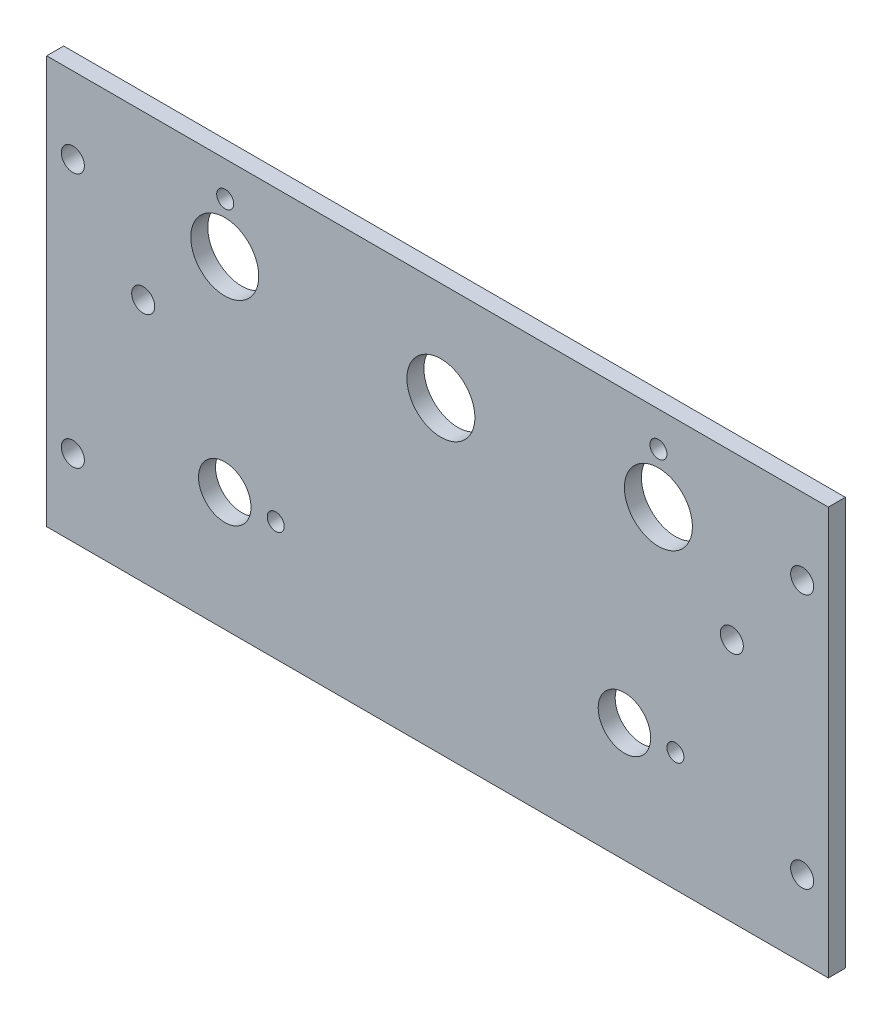
from build123d import *

# Parameters (mm, degrees)
SKETCH1_W                                    = 146.05
SKETCH1_H                                    = 76.2
BACKPLATE_BODY_DEPTH                         = 3.175
F_6_PANEL_SCREW_HOLES_D                      = 4.3053
F_1_2_SWITCH_HOLES_D                         = 12.7
F_1_8_0_125_SWITCH_ANTI_ROTATION_HOLES_D     = 3.175
F_3_8_0_375_ROTARY_SWITCH_HOLES_D            = 9.8044
ROTARY_SWITCH_ANTI_ROTATION_HOLES_DEPTH      = 165.763840466
ROTARY_SWITCH_ANTI_ROTATION_HOLES_DEPTH_BACK = 165.763840466
SKETCH11_R                                   = 1.5875


with BuildPart() as part:
    # Sketch1 → Backplate Body (new body)
    with BuildSketch(Plane.XY):
        with Locations((-73.025, 38.1)):
            Rectangle(SKETCH1_W, SKETCH1_H)
    extrude(amount=-BACKPLATE_BODY_DEPTH)

    # #6 Panel Screw Holes (through all)
    with Locations(Plane(origin=(0, 0, -3.175), x_dir=(-1, 0, 0), z_dir=(0, 0, -1))):
        with Locations((4.8895, 61.9125), (4.8895, 14.2875), (141.1605, 14.2875), (141.1605, 61.9125), (128.016, 45.72), (18.034, 45.72)):
            Hole(F_6_PANEL_SCREW_HOLES_D / 2)

    # 1/2 Switch Holes (through all)
    with Locations(Plane(origin=(0, 0, -3.175), x_dir=(-1, 0, 0), z_dir=(0, 0, -1))):
        with Locations((31.75, 60.325), (72.39, 57.658), (112.776, 60.325)):
            Hole(F_1_2_SWITCH_HOLES_D / 2)

    # 1/8 (0.125) Switch Anti-Rotation Holes (through all)
    with Locations(Plane(origin=(0, 0, -3.175), x_dir=(-1, 0, 0), z_dir=(0, 0, -1))):
        with Locations((31.75, 69.699492067), (112.695431447, 69.699492067)):
            Hole(F_1_8_0_125_SWITCH_ANTI_ROTATION_HOLES_D / 2)

    # 3/8 (0.375) Rotary Switch Holes (through all)
    with Locations(Plane(origin=(0, 0, -3.175), x_dir=(-1, 0, 0), z_dir=(0, 0, -1))):
        with Locations((38.1, 22.225), (112.776, 22.225)):
            Hole(F_3_8_0_375_ROTARY_SWITCH_HOLES_D / 2)

    # Sketch11 → Rotary Switch Anti-Rotation Holes (cut, two sides: drawn at the far end of the back side and taken through both)
    with BuildSketch(Plane.XY.offset(-ROTARY_SWITCH_ANTI_ROTATION_HOLES_DEPTH_BACK)):
        with Locations((-103.251, 22.225)):
            Circle(SKETCH11_R)
        with Locations((-28.575, 22.225)):
            Circle(SKETCH11_R)
    extrude(amount=ROTARY_SWITCH_ANTI_ROTATION_HOLES_DEPTH + ROTARY_SWITCH_ANTI_ROTATION_HOLES_DEPTH_BACK, mode=Mode.SUBTRACT)


solid = part.part
